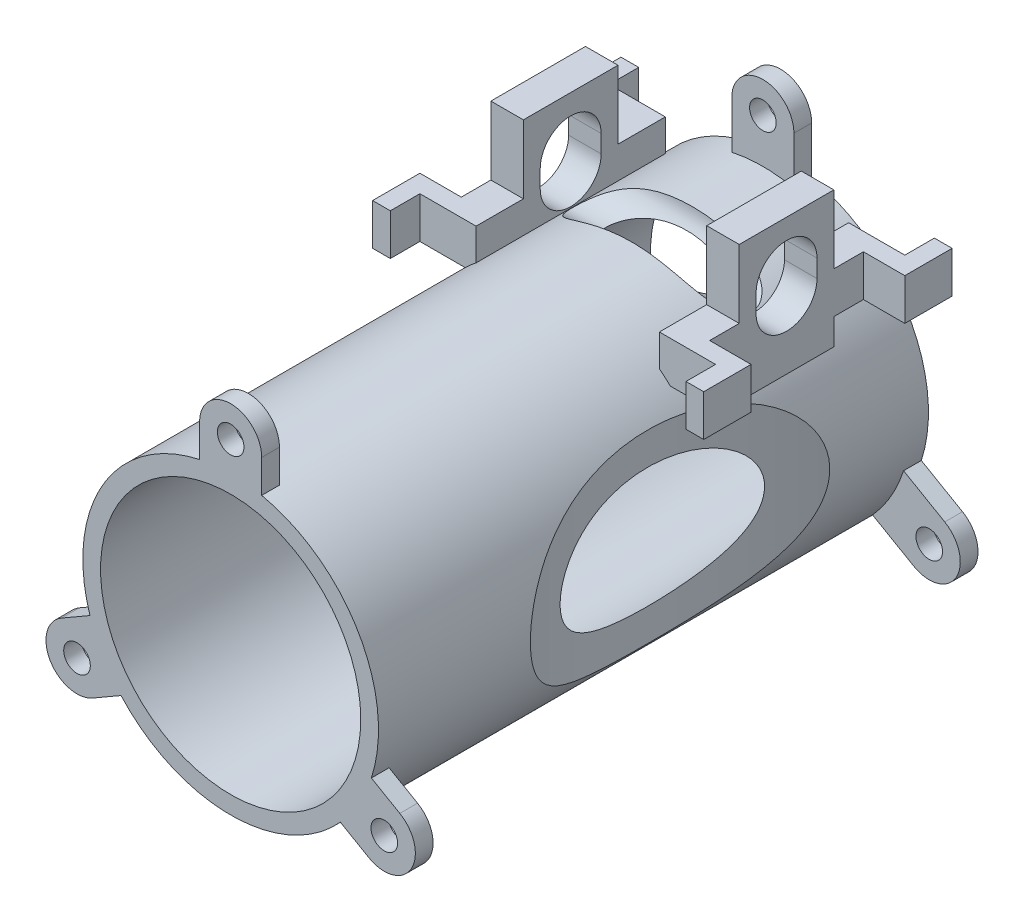
from build123d import *

# Parameters (mm, degrees)
SKETCH1_R               = 25
SKETCH1_R_2             = 22
BOSS_EXTRUDE1_DEPTH     = 40
SKETCH3_R               = 5.15
CUT_EXTRUDE1_DEPTH      = 25
SKETCH7_R               = 25
SKETCH7_R_2             = 22
BOSS_EXTRUDE4_DEPTH     = 53
SKETCH9_R               = 2.25
BOSS_EXTRUDE5_DEPTH     = 3
CIRPATTERN1_COUNT       = 3
BOSS_EXTRUDE6_START     = -3
SKETCH10_R              = 2.25
BOSS_EXTRUDE6_DEPTH     = 3
CIRPATTERN2_COUNT       = 3
BOSS_EXTRUDE7_DEPTH     = 8
CUT_EXTRUDE5_START      = -16
CUT_EXTRUDE5_DEPTH      = 16
BOSS_EXTRUDE8_DEPTH     = 7
MIRROR2_COPY_1_DEPTH    = 7
CUT_EXTRUDE4_DEPTH      = 6
CUT_EXTRUDE4_DEPTH_BACK = 41
SKETCH12_R              = 61


with BuildPart() as part:
    # Sketch1 → Boss-Extrude1 (new body)
    with BuildSketch(Plane.XY):
        Circle(SKETCH1_R)
        Circle(SKETCH1_R_2, mode=Mode.SUBTRACT)
    extrude(amount=BOSS_EXTRUDE1_DEPTH)

    # Sketch3 → Cut-Extrude1 (cut, symmetric)
    with BuildSketch(Plane(origin=(0, 0, 0), x_dir=(0, 0, -1), z_dir=(1, 0, 0))):
        with Locations((-20, 25)):
            Circle(SKETCH3_R)
    extrude(amount=CUT_EXTRUDE1_DEPTH, both=True, mode=Mode.SUBTRACT)

    # Sketch7 → Boss-Extrude4 (add)
    with BuildSketch(Plane.XY.offset(40)):
        Circle(SKETCH7_R)
        Circle(SKETCH7_R_2, mode=Mode.SUBTRACT)
    extrude(amount=BOSS_EXTRUDE4_DEPTH)

    # Sketch9 → Boss-Extrude5 (add)
    with BuildSketch(Plane(origin=(0, 0, 0), x_dir=(-1, 0, 0), z_dir=(0, 0, -1))):
        with BuildLine():
            Line((5.25, 24.442534648), (5.25, 32.484665375))
            ThreePointArc((5.25, 32.484665375), (0, 37.734665375), (-5.25, 32.484665375))
            Line((-5.25, 32.484665375), (-5.25, 24.442534648))
            ThreePointArc((-5.25, 24.442534648), (0, 25), (5.25, 24.442534648))
        make_face()
        with Locations((0, 32.484665375)):
            Circle(SKETCH9_R, mode=Mode.SUBTRACT)
    boss_extrude5 = extrude(amount=-BOSS_EXTRUDE5_DEPTH)

    # CirPattern1: Boss-Extrude5 ×3 about axis
    cirpattern1_axis = Axis((0, 0, 0), (0, 0, 1))
    for i in range(1, CIRPATTERN1_COUNT):
        add(boss_extrude5.rotate(cirpattern1_axis, i * 360 / CIRPATTERN1_COUNT))

    # Sketch10 → Boss-Extrude6 (add)
    with BuildSketch(Plane.XY.offset(93).offset(BOSS_EXTRUDE6_START)):
        with BuildLine():
            ThreePointArc((-5.25, 24.442534648), (0, 25), (5.25, 24.442534648))
            Line((5.25, 24.442534648), (5.25, 30))
            ThreePointArc((5.25, 30), (0, 35.25), (-5.25, 30))
            Line((-5.25, 30), (-5.25, 24.442534648))
        make_face()
        with Locations((0, 30)):
            Circle(SKETCH10_R, mode=Mode.SUBTRACT)
    boss_extrude6 = extrude(amount=BOSS_EXTRUDE6_DEPTH)

    # CirPattern2: Boss-Extrude6 ×3 about axis
    cirpattern2_axis = Axis((0, 0, 93), (0, 0, 1))
    for i in range(1, CIRPATTERN2_COUNT):
        add(boss_extrude6.rotate(cirpattern2_axis, i * 360 / CIRPATTERN2_COUNT))

    # Sketch14 → Boss-Extrude7 (add, symmetric)
    with BuildSketch(Plane.XY.offset(20)):
        with BuildLine():
            Line((-21, 13.564659966), (-21, 36.564659966))
            Line((-21, 36.564659966), (-15.5, 36.564659966))
            Line((-15.5, 36.564659966), (-15.5, 19.615045246))
            ThreePointArc((-15.5, 19.615045246), (-18.499034853, 16.816233511), (-21, 13.564659966))
        make_face()
    boss_extrude7 = extrude(amount=BOSS_EXTRUDE7_DEPTH, both=True)

    # Sketch15 → Cut-Extrude5 (cut)
    with BuildSketch(Plane.ZY.offset(21).offset(CUT_EXTRUDE5_START)):
        with BuildLine():
            Line((14.85, 25), (14.85, 28))
            ThreePointArc((14.85, 28), (20, 33.15), (25.15, 28))
            Line((25.15, 28), (25.15, 25))
            ThreePointArc((25.15, 25), (20, 19.85), (14.85, 25))
        make_face()
    cut_extrude5 = extrude(amount=CUT_EXTRUDE5_DEPTH, mode=Mode.SUBTRACT)

    # Sketch17 → Boss-Extrude8 (add)
    with BuildSketch(Plane(origin=(0, 25, 0), x_dir=(1, 0, 0), z_dir=(0, 1, 0))):
        Polygon((-15.5, -28), (-21, -28), (-21, -33), (-28, -33), (-28, -41), (-25, -41), (-25, -36), (-15.5, -36), align=None)
    boss_extrude8 = extrude(amount=-BOSS_EXTRUDE8_DEPTH)

    # Mirror1: Boss-Extrude8 across plane
    add(boss_extrude8.mirror(Plane.XY.offset(20)))

    # Mirror2: Boss-Extrude7, Cut-Extrude5, Boss-Extrude8 across plane
    add(boss_extrude7.mirror(Plane(origin=(0, 0, 0), x_dir=(0, 0, 1), z_dir=(1, 0, 0))))
    add(cut_extrude5.mirror(Plane(origin=(0, 0, 0), x_dir=(0, 0, 1), z_dir=(1, 0, 0))), mode=Mode.SUBTRACT)
    add(boss_extrude8.mirror(Plane(origin=(0, 0, 0), x_dir=(0, 0, 1), z_dir=(1, 0, 0))))

    # Mirror2 copy 1 sketch → Mirror2 copy 1 (add)
    with BuildSketch(Plane(origin=(0, 25, 40), x_dir=(-1, 0, 0), z_dir=(0, 1, 0))):
        Polygon((-15.5, -28), (-21, -28), (-21, -33), (-28, -33), (-28, -41), (-25, -41), (-25, -36), (-15.5, -36), align=None)
    extrude(amount=-MIRROR2_COPY_1_DEPTH)

    # Sketch12 → Cut-Extrude4 (cut, two sides: drawn at the far end of the back side and taken through both)
    with BuildSketch(Plane(origin=(0, 11.51, 0), x_dir=(1, 0, 0), z_dir=(0, 1, 0)).offset(-CUT_EXTRUDE4_DEPTH_BACK)):
        with Locations((-80.5, -42)):
            Circle(SKETCH12_R)
        with Locations((80.5, -42)):
            Circle(SKETCH12_R)
    extrude(amount=CUT_EXTRUDE4_DEPTH + CUT_EXTRUDE4_DEPTH_BACK, mode=Mode.SUBTRACT)


solid = part.part
